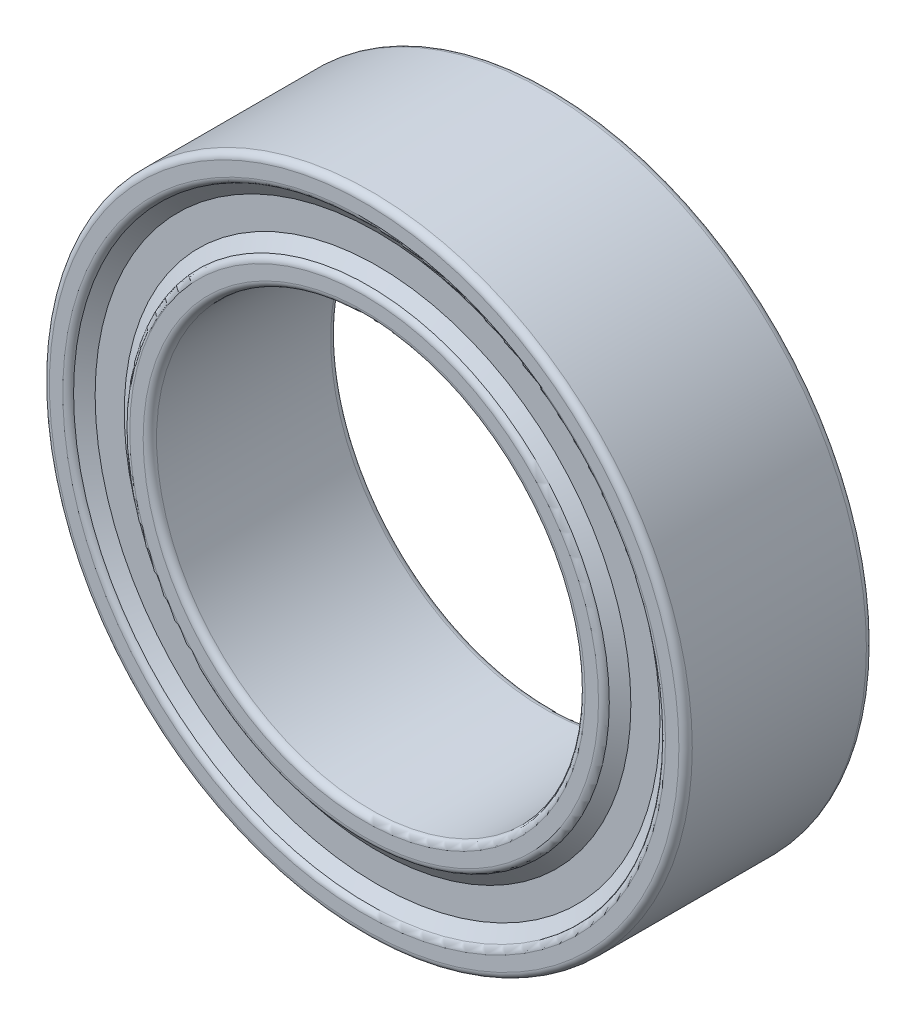
from build123d import *

# Parameters (mm, degrees)
SKETCH1_R           = 6
SKETCH1_R_2         = 4
BOSS_EXTRUDE1_DEPTH = 3.5
SKETCH2_R           = 5.5
SKETCH2_R_2         = 4.5
CUT_EXTRUDE1_DEPTH  = 0.25
CUT_EXTRUDE2_START  = -3
SKETCH2_2_R         = 5.5
SKETCH2_2_R_2       = 4.5
CUT_EXTRUDE2_DEPTH  = 0.5
FILLET1_R           = 0.125


with BuildPart() as part:
    # Sketch1 → Boss-Extrude1 (new body)
    with BuildSketch(Plane.XY):
        Circle(SKETCH1_R)
        Circle(SKETCH1_R_2, mode=Mode.SUBTRACT)
    extrude(amount=BOSS_EXTRUDE1_DEPTH)

    # Sketch2 → Cut-Extrude1 (cut)
    with BuildSketch(Plane.XY.offset(3.5)):
        Circle(SKETCH2_R)
        Circle(SKETCH2_R_2, mode=Mode.SUBTRACT)
    extrude(amount=-CUT_EXTRUDE1_DEPTH, mode=Mode.SUBTRACT)

    # Sketch2<2> → Cut-Extrude2 (cut)
    with BuildSketch(Plane.XY.offset(3.5).offset(CUT_EXTRUDE2_START)):
        Circle(SKETCH2_2_R)
        Circle(SKETCH2_2_R_2, mode=Mode.SUBTRACT)
    extrude(amount=-CUT_EXTRUDE2_DEPTH, mode=Mode.SUBTRACT)

    # Fillet1
    fillet1_edges = [part.edges().sort_by_distance(p)[0] for p in [
        (-5.5, 0, 3.5),
        (-4.5, 0, 3.5),
        (-4.5, 0, 0),
        (-5.5, 0, 0),
        (-6, 0, 0),
        (-6, 0, 3.5),
        (-4, 0, 0),
        (-4, 0, 3.5),
    ]]
    fillet(fillet1_edges, radius=FILLET1_R)

    # Chamfer1: read off the stored shape, not the designer's step
    # Chamfer1 outline → Chamfer1 (revolve)
    with BuildSketch(Plane.XZ):
        Polygon((5.271446609, 3.25), (5.5, 3.25), (5.5, 3.375), (5.50714887, 3.375), (5.50714887, 3.416666667), align=None)
        Polygon((5.5, 0.5), (5.25, 0.5), (5.5, 0.25), align=None)
        Polygon((4.5, 3.25), (4.728553391, 3.25), (4.49285113, 3.416666667), (4.49285113, 3.375), (4.5, 3.375), align=None)
        Polygon((4.75, 0.5), (4.5, 0.5), (4.5, 0.25), align=None)
    revolve(axis=Axis((0, 0, 0), (0, 0, 1)))


solid = part.part
